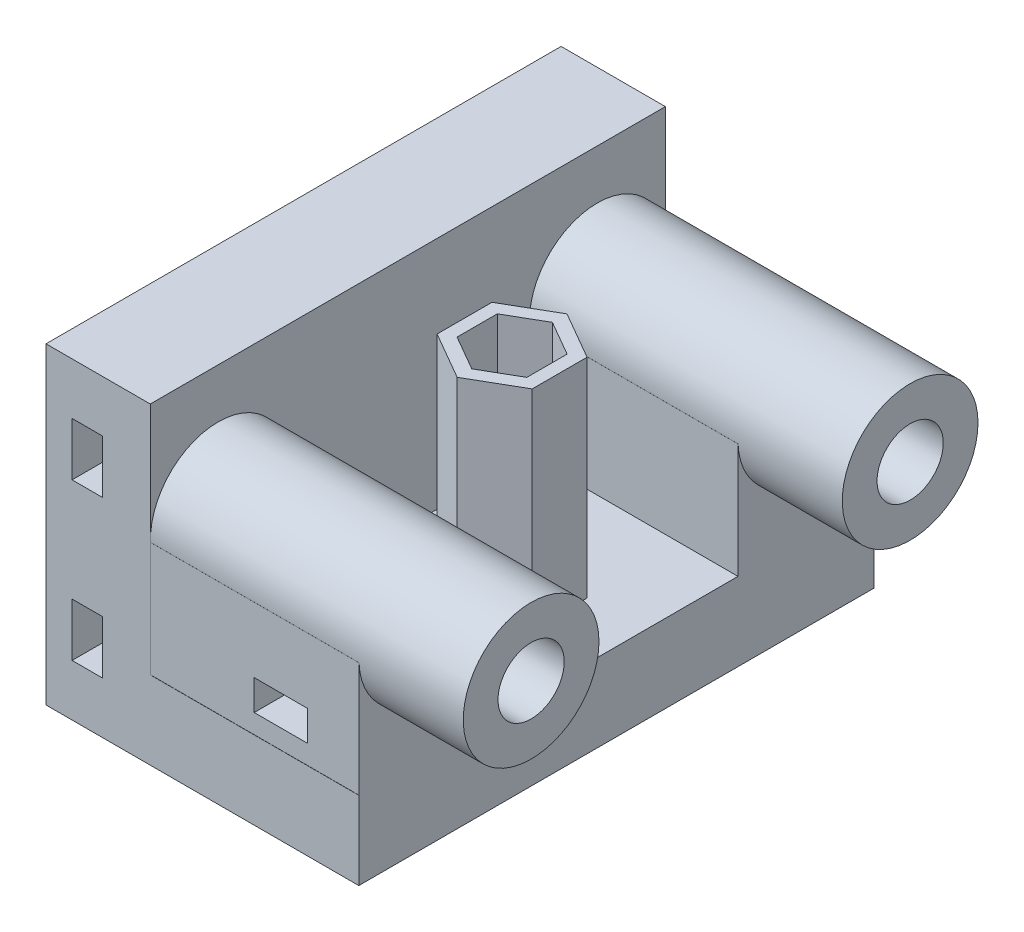
from build123d import *

# Parameters (mm, degrees)
SKETCH1_W           = 88.9
SKETCH1_H           = 76.2
BOSS_EXTRUDE1_DEPTH = 25.4
SKETCH2_R           = 4.1021
CUT_EXTRUDE1_DEPTH  = 19.05
SKETCH3_W           = 7.366
SKETCH3_H           = 12.954
CUT_EXTRUDE2_DEPTH  = 15.24
SKETCH5_W           = 88.9
SKETCH5_H           = 19.05
BOSS_EXTRUDE2_DEPTH = 50.8
SKETCH6_R           = 16.53116582
SKETCH6_R_2         = 8.0645
BOSS_EXTRUDE3_DEPTH = 76.2
SKETCH7_W           = 7.366
SKETCH7_H           = 12.954
BOSS_EXTRUDE4_DEPTH = 18.288
SKETCH8_W           = 50.8
SKETCH8_H           = 33.06233164
BOSS_EXTRUDE5_DEPTH = 27.94
CUT_EXTRUDE5_START  = -76.2
SKETCH11_R          = 8.0645
CUT_EXTRUDE5_DEPTH  = 76.2
CUT_EXTRUDE6_REACH  = 168.187
SKETCH12_R          = 4.1021
SKETCH13_W          = 12.954
SKETCH13_H          = 7.366
CUT_EXTRUDE7_DEPTH  = 22.9616
BOSS_EXTRUDE6_DEPTH = 50.8
CUT_EXTRUDE8_REACH  = 160.36
SKETCH14_3_R        = 5.25
CUT_EXTRUDE9_DEPTH  = 9


with BuildPart() as part:
    # Sketch1 → Boss-Extrude1 (new body)
    with BuildSketch(Plane(origin=(0, 0, 0), x_dir=(0, 0, -1), z_dir=(1, 0, 0))):
        with Locations((44.45, 38.1)):
            Rectangle(SKETCH1_W, SKETCH1_H)
    extrude(amount=BOSS_EXTRUDE1_DEPTH)

    # Sketch2 → Cut-Extrude1 (cut)
    with BuildSketch(Plane.ZY):
        with Locations((-80.264, 57.15)):
            Circle(SKETCH2_R)
        with Locations((-80.264, 19.05)):
            Circle(SKETCH2_R)
        with Locations((-8.636, 19.05)):
            Circle(SKETCH2_R)
        with Locations((-8.636, 57.15)):
            Circle(SKETCH2_R)
    extrude(amount=-CUT_EXTRUDE1_DEPTH, mode=Mode.SUBTRACT)

    # Sketch3 → Cut-Extrude2 (cut)
    with BuildSketch(Plane.XY):
        with Locations((10.033, 57.15)):
            Rectangle(SKETCH3_W, SKETCH3_H)
        with Locations((10.033, 19.05)):
            Rectangle(SKETCH3_W, SKETCH3_H)
    cut_extrude2 = extrude(amount=-CUT_EXTRUDE2_DEPTH, mode=Mode.SUBTRACT)

    # Mirror1: Cut-Extrude2 across plane
    add(cut_extrude2.mirror(Plane.XY.offset(-44.45)), mode=Mode.SUBTRACT)

    # Sketch5 → Boss-Extrude2 (add)
    with BuildSketch(Plane(origin=(25.4, 0, 0), x_dir=(0, 0, -1), z_dir=(1, 0, 0))):
        with Locations((44.45, 9.525)):
            Rectangle(SKETCH5_W, SKETCH5_H)
    extrude(amount=BOSS_EXTRUDE2_DEPTH)

    # Sketch6 → Boss-Extrude3 (add)
    # profile 1 of 2: a face of its own
    with BuildSketch(Plane(origin=(25.4, 0, 0), x_dir=(0, 0, -1), z_dir=(1, 0, 0))):
        with Locations((-1.7145, 47.625)):
            Circle(SKETCH6_R)
        with Locations((-1.7145, 47.625)):
            Circle(SKETCH6_R_2, mode=Mode.SUBTRACT)
    # profile 2 of 2: a face of its own
    with BuildSketch(Plane(origin=(25.4, 0, 0), x_dir=(0, 0, -1), z_dir=(1, 0, 0))):
        with Locations((90.6145, 47.625)):
            Circle(SKETCH6_R)
        with Locations((90.6145, 47.625)):
            Circle(SKETCH6_R_2, mode=Mode.SUBTRACT)
    extrude(amount=BOSS_EXTRUDE3_DEPTH)

    # Sketch7 → Boss-Extrude4 (add)
    with BuildSketch(Plane.XY):
        Polygon((76.2, 19.05), (25.4, 19.05), (25.4, 76.2), (0, 76.2), (0, 0), (76.2, 0), align=None)
        with Locations((10.033, 57.15)):
            Rectangle(SKETCH7_W, SKETCH7_H, mode=Mode.SUBTRACT)
        with Locations((10.033, 19.05)):
            Rectangle(SKETCH7_W, SKETCH7_H, mode=Mode.SUBTRACT)
    boss_extrude4 = extrude(amount=BOSS_EXTRUDE4_DEPTH)

    # Mirror2: Boss-Extrude4 across plane
    add(boss_extrude4.mirror(Plane.XY.offset(-44.45)))

    # Sketch8 → Boss-Extrude5 (add)
    with BuildSketch(Plane(origin=(0, 19.05, 0), x_dir=(1, 0, 0), z_dir=(0, 1, 0))):
        with Locations((50.8, -1.7145)):
            Rectangle(SKETCH8_W, SKETCH8_H)
    boss_extrude5 = extrude(amount=BOSS_EXTRUDE5_DEPTH)

    # Sketch11 → Cut-Extrude5 (cut)
    with BuildSketch(Plane(origin=(101.6, 0, 0), x_dir=(0, 0, -1), z_dir=(1, 0, 0)).offset(CUT_EXTRUDE5_START)):
        with Locations((-1.7145, 47.625)):
            Circle(SKETCH11_R)
    cut_extrude5 = extrude(amount=CUT_EXTRUDE5_DEPTH, mode=Mode.SUBTRACT)

    # Sketch12 → Cut-Extrude6 (cut, up to next)
    with BuildSketch(Plane.XZ, mode=Mode.PRIVATE) as cut_extrude6_sk1:
        with Locations((57.15, 1.7145)):
            Circle(SKETCH12_R)
    cut_extrude6_tool1 = extrude(cut_extrude6_sk1.sketch, amount=-CUT_EXTRUDE6_REACH, mode=Mode.PRIVATE) & part.part
    cut_extrude6 = cut_extrude6_tool1.solids().sort_by_distance((57.15, 0, 1.7145))[0]
    add(cut_extrude6, mode=Mode.SUBTRACT)

    # Sketch13 → Cut-Extrude7 (cut)
    with BuildSketch(Plane.XY.offset(18.24566582)):
        with Locations((57.15, 27.41083418)):
            Rectangle(SKETCH13_W, SKETCH13_H)
    cut_extrude7 = extrude(amount=-CUT_EXTRUDE7_DEPTH, mode=Mode.SUBTRACT)

    # Mirror3: Boss-Extrude5, Cut-Extrude5, Cut-Extrude6, Cut-Extrude7 across plane
    add(boss_extrude5.mirror(Plane.XY.offset(-44.45)))
    add(cut_extrude5.mirror(Plane.XY.offset(-44.45)), mode=Mode.SUBTRACT)
    add(cut_extrude6.mirror(Plane.XY.offset(-44.45)), mode=Mode.SUBTRACT)
    add(cut_extrude7.mirror(Plane.XY.offset(-44.45)), mode=Mode.SUBTRACT)

    # Sketch14 → Boss-Extrude6 (add)
    with BuildSketch(Plane(origin=(0, 19.05, 0), x_dir=(1, 0, 0), z_dir=(0, 1, 0))):
        Polygon((62.381615184, 51.136648644), (50.8, 57.823297288), (39.218384816, 51.136648644), (39.218384816, 37.763351356), (50.8, 31.076702712), (62.381615184, 37.763351356), align=None)
        Polygon((50.8, 34.635045424), (42.3, 39.542522712), (42.3, 49.357477288), (50.8, 54.264954576), (59.3, 49.357477288), (59.3, 39.542522712), align=None, mode=Mode.SUBTRACT)
    extrude(amount=BOSS_EXTRUDE6_DEPTH)

    # Sketch14<3> → Cut-Extrude8 (cut, up to next)
    with BuildSketch(Plane(origin=(0, 19.05, 0), x_dir=(1, 0, 0), z_dir=(0, 1, 0)), mode=Mode.PRIVATE) as cut_extrude8_sk1:
        with Locations((50.8, 44.45)):
            Circle(SKETCH14_3_R)
    cut_extrude8_tool1 = extrude(cut_extrude8_sk1.sketch, amount=-CUT_EXTRUDE8_REACH, mode=Mode.PRIVATE) & part.part
    add(cut_extrude8_tool1.solids().sort_by_distance((50.8, 19.05, -44.45))[0], mode=Mode.SUBTRACT)

    # Sketch15 → Cut-Extrude9 (cut)
    with BuildSketch(Plane.XZ):
        Polygon((59.35, -39.513655198), (50.8, -34.577310397), (42.25, -39.513655198), (42.25, -49.386344802), (50.8, -54.322689603), (59.35, -49.386344802), align=None)
    extrude(amount=-CUT_EXTRUDE9_DEPTH, mode=Mode.SUBTRACT)


solid = part.part
